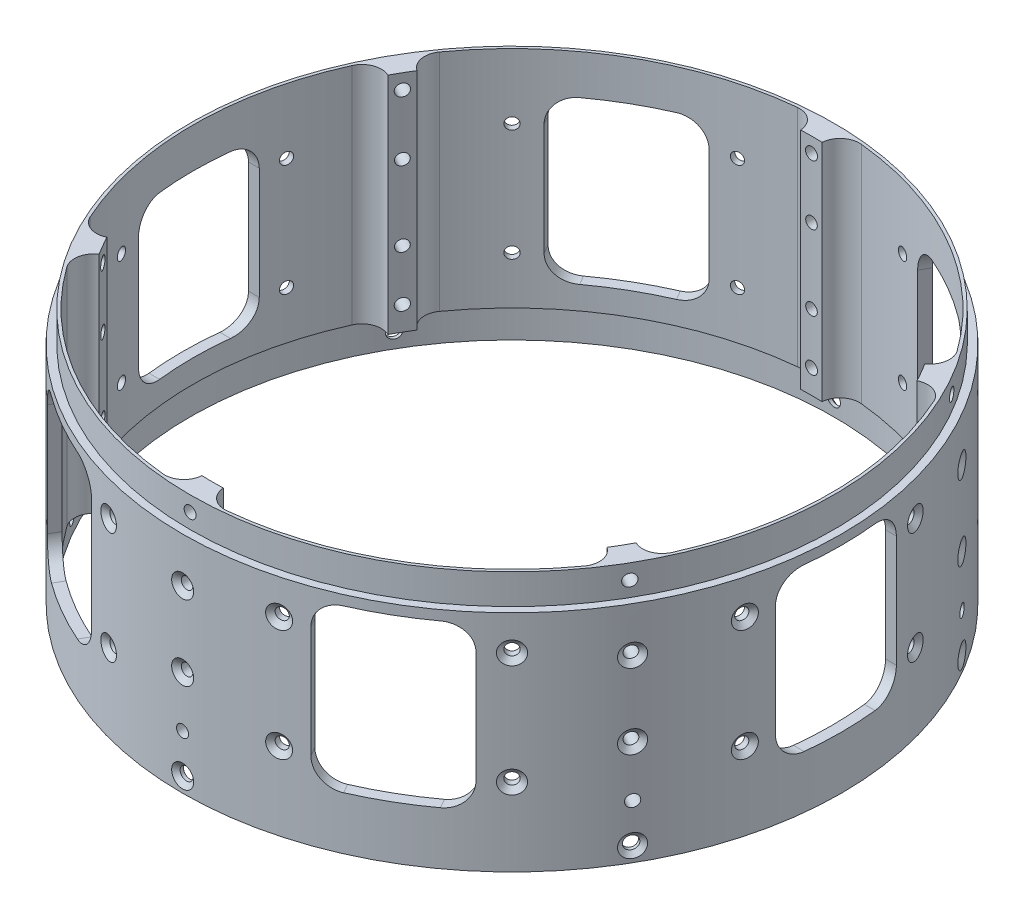
from build123d import *

# Parameters (mm, degrees)
CUT_EXTRUDE1_DEPTH                          = 136.0804860074171
CIRPATTERN1_COUNT                           = 6
TAPPED_HOLE_FOR_4_40_HELICOIL1_AT_2_COUNT   = 2
TAPPED_HOLE_FOR_4_40_HELICOIL1_AT_2_PITCH   = 47.244
CSK_FOR_4_FLAT_HEAD_MACHINE_SCREW_2_A_COUNT = 2
CSK_FOR_4_FLAT_HEAD_MACHINE_SCREW_2_A_PITCH = 19.049999999999997
CIRPATTERN2_COUNT                           = 6
CUT_EXTRUDE2_DEPTH                          = 136.08048618293648
CSK_FOR_4_FLAT_HEAD_MACHINE_SCREW_3_A_COUNT = 2
CSK_FOR_4_FLAT_HEAD_MACHINE_SCREW_3_A_PITCH = 28.448
CIRPATTERN5_COUNT                           = 6


with BuildPart() as part:
    # Sketch1 → Revolve1 (revolve)
    with BuildSketch(Plane.XY):
        Polygon((76.2, -57.15), (76.20000000000003, 0), (81.88960000000003, 0), (81.88960000000003, -7.6708), (83.82000000000004, -7.670799999999989), (83.82000000000004, -64.77), (81.94040000000005, -64.77), (81.94040000000004, -57.15), align=None)
    revolve(axis=Axis((0, 42.39510168777739, 0), (0, -1, 0)))

    # Sketch2 → Cut-Extrude1 (cut, through all)
    with BuildSketch(Plane(origin=(0, 0, 0), x_dir=(1, 0, 0), z_dir=(0, 1, 0))):
        with BuildLine():
            ThreePointArc((-8.128016987239903, 80.71940796125271), (-40.563800000000136, 70.25856254806241), (-65.8410493792649, 47.39877317396734))
            ThreePointArc((-65.8410493792649, 47.39877317396734), (-64.72088607812911, 40.52071256804154), (-57.842825472203295, 41.64087586917733))
            ThreePointArc((-57.842825472203295, 41.64087586917733), (-35.63620000000011, 61.72370898868599), (-7.140643602440563, 70.9137942201863))
            ThreePointArc((-7.140643602440563, 70.9137942201863), (-2.7315234243070465, 76.3102877831192), (-8.128016987239903, 80.71940796125271))
        make_face()
    cut_extrude1 = extrude(amount=-CUT_EXTRUDE1_DEPTH, mode=Mode.SUBTRACT)

    # CirPattern1: Cut-Extrude1 ×6 about axis
    cirpattern1_axis = Axis((0, 42.39510168777739, 0), (0, 1, 0))
    for i in range(1, CIRPATTERN1_COUNT):
        add(cut_extrude1.rotate(cirpattern1_axis, i * 360 / CIRPATTERN1_COUNT), mode=Mode.SUBTRACT)

    # Sketch4 → Tapped Hole for #4-40 Helicoil1 (revolve, cut)
    with BuildSketch(Plane(origin=(0, -3.8099999999999996, 83.82), x_dir=(0, -1, 0), z_dir=(1, 0, 0))):
        Polygon((0, 0), (-6.45e-15, 26.315711583398002), (1.5239999999999854, 25.400000000000006), (1.523999999999989, -1.37e-15), align=None)
    tapped_hole_for_4_40_helicoil1 = revolve(axis=Axis((0, -3.8099999999999996, 90.16999999999999), (0, 0, -1)), mode=Mode.SUBTRACT)

    # Tapped Hole for #4-40 Helicoil1 at 2: Tapped Hole for #4-40 Helicoil1 ×2
    with Locations(*[(0, -i * TAPPED_HOLE_FOR_4_40_HELICOIL1_AT_2_PITCH, 0) for i in range(1, TAPPED_HOLE_FOR_4_40_HELICOIL1_AT_2_COUNT)]):
        add(tapped_hole_for_4_40_helicoil1, mode=Mode.SUBTRACT)

    # Sketch6 → CSK for _4 Flat Head Machine Screw _100 (revolve, cut)
    with BuildSketch(Plane(origin=(1.24e-15, -60.96, 83.82), x_dir=(0, -1, 0), z_dir=(1, 0, 0))):
        Polygon((0, 0), (-6.45e-15, 26.380574487222027), (1.6319499999999938, 25.4), (1.631949999999997, 1.0283585529893176), (2.8575, 0), align=None)
    csk_for_4_flat_head_machine_screw_100 = revolve(axis=Axis((1.24e-15, -60.96, 90.16999999999999), (0, 0, -1)), mode=Mode.SUBTRACT)

    # Sketch9 → CSK for _4 Flat Head Machine Screw _ 2 (revolve, cut)
    with BuildSketch(Plane(origin=(0, -19.049999999999997, 83.82), x_dir=(0, -1, 0), z_dir=(1, 0, 0))):
        Polygon((0, 0), (-6.44e-15, 26.2851878639514), (1.473199999999994, 25.4), (1.473199999999997, 1.1615656194387154), (2.857499999999999, -1.73e-15), align=None)
    csk_for_4_flat_head_machine_screw_2 = revolve(axis=Axis((0, -19.049999999999997, 90.16999999999999), (0, 0, -1)), mode=Mode.SUBTRACT)

    # CSK for _4 Flat Head Machine Screw _ 2 a: CSK for _4 Flat Head Machine Screw _ 2 ×2
    with Locations(*[(0, -i * CSK_FOR_4_FLAT_HEAD_MACHINE_SCREW_2_A_PITCH, 0) for i in range(1, CSK_FOR_4_FLAT_HEAD_MACHINE_SCREW_2_A_COUNT)]):
        add(csk_for_4_flat_head_machine_screw_2, mode=Mode.SUBTRACT)

    # CirPattern2: Tapped Hole for #4-40 Helicoil1, CSK for _4 Flat Head Machine Screw _100, CSK for _4 Flat Head Machine Screw _ 2 ×6 about axis
    cirpattern2_axis = Axis((0, 42.39510168777739, 0), (0, 1, 0))
    add([tapped_hole_for_4_40_helicoil1.rotate(cirpattern2_axis, i * 360 / CIRPATTERN2_COUNT) for i in range(1, CIRPATTERN2_COUNT)], mode=Mode.SUBTRACT)
    add([csk_for_4_flat_head_machine_screw_100.rotate(cirpattern2_axis, i * 360 / CIRPATTERN2_COUNT) for i in range(1, CIRPATTERN2_COUNT)], mode=Mode.SUBTRACT)
    add([csk_for_4_flat_head_machine_screw_2.rotate(cirpattern2_axis, i * 360 / CIRPATTERN2_COUNT) for i in range(1, CIRPATTERN2_COUNT)], mode=Mode.SUBTRACT)

    # CirPattern2 copy 1 sketch → CirPattern2 copy 1 (revolve, cut)
    with BuildSketch(Plane(origin=(72.59024934521163, -51.054, 41.910000000000004), x_dir=(0, -1, 0), z_dir=(0.5000000000000001, 0, -0.8660254037844386))):
        Polygon((0, 0), (-6.45e-15, 26.315711583398002), (1.5239999999999854, 25.400000000000006), (1.523999999999989, -1.37e-15), align=None)
    revolve(axis=Axis((78.08951065924282, -51.054, 45.085), (-0.8660254037844386, 0, -0.5000000000000001)), mode=Mode.SUBTRACT)

    # CirPattern2 copy 2 sketch → CirPattern2 copy 2 (revolve, cut)
    with BuildSketch(Plane(origin=(72.59024934521165, -51.054, -41.909999999999975), x_dir=(0, -1, 0), z_dir=(-0.4999999999999998, 0, -0.8660254037844387))):
        Polygon((0, 0), (-6.45e-15, 26.315711583398002), (1.5239999999999854, 25.400000000000006), (1.523999999999989, -1.37e-15), align=None)
    revolve(axis=Axis((78.08951065924283, -51.054, -45.08499999999997), (-0.8660254037844387, 0, 0.4999999999999998)), mode=Mode.SUBTRACT)

    # CirPattern2 copy 3 sketch → CirPattern2 copy 3 (revolve, cut)
    with BuildSketch(Plane(origin=(1.026e-14, -51.054, -83.82), x_dir=(0, -1, 0), z_dir=(-1, 0, -1.2e-16))):
        Polygon((0, 0), (-6.45e-15, 26.315711583398002), (1.5239999999999854, 25.400000000000006), (1.523999999999989, -1.37e-15), align=None)
    revolve(axis=Axis((1.104e-14, -51.054, -90.16999999999999), (-1.2e-16, 0, 1)), mode=Mode.SUBTRACT)

    # CirPattern2 copy 4 sketch → CirPattern2 copy 4 (revolve, cut)
    with BuildSketch(Plane(origin=(-72.59024934521162, -51.054, -41.91000000000003), x_dir=(0, -1, 0), z_dir=(-0.5000000000000004, 0, 0.8660254037844384))):
        Polygon((0, 0), (-6.45e-15, 26.315711583398002), (1.5239999999999854, 25.400000000000006), (1.523999999999989, -1.37e-15), align=None)
    revolve(axis=Axis((-78.08951065924279, -51.054, -45.085000000000036), (0.8660254037844384, 0, 0.5000000000000004)), mode=Mode.SUBTRACT)

    # CirPattern2 copy 5 sketch → CirPattern2 copy 5 (revolve, cut)
    with BuildSketch(Plane(origin=(-72.59024934521163, -51.054, 41.910000000000004), x_dir=(0, -1, 0), z_dir=(0.5000000000000001, 0, 0.8660254037844386))):
        Polygon((0, 0), (-6.45e-15, 26.315711583398002), (1.5239999999999854, 25.400000000000006), (1.523999999999989, -1.37e-15), align=None)
    revolve(axis=Axis((-78.08951065924282, -51.054, 45.085), (0.8660254037844386, 0, -0.5000000000000001)), mode=Mode.SUBTRACT)

    # CirPattern2 copy 6 sketch → CirPattern2 copy 6 (revolve, cut)
    with BuildSketch(Plane(origin=(72.59024934521163, -38.099999999999994, 41.910000000000004), x_dir=(0, -1, 0), z_dir=(0.5000000000000001, 0, -0.8660254037844386))):
        Polygon((0, 0), (-6.44e-15, 26.2851878639514), (1.473199999999994, 25.4), (1.473199999999997, 1.1615656194387154), (2.857499999999999, -1.73e-15), align=None)
    revolve(axis=Axis((78.08951065924282, -38.099999999999994, 45.085), (-0.8660254037844386, 0, -0.5000000000000001)), mode=Mode.SUBTRACT)

    # CirPattern2 copy 7 sketch → CirPattern2 copy 7 (revolve, cut)
    with BuildSketch(Plane(origin=(72.59024934521165, -38.099999999999994, -41.909999999999975), x_dir=(0, -1, 0), z_dir=(-0.4999999999999998, 0, -0.8660254037844387))):
        Polygon((0, 0), (-6.44e-15, 26.2851878639514), (1.473199999999994, 25.4), (1.473199999999997, 1.1615656194387154), (2.857499999999999, -1.73e-15), align=None)
    revolve(axis=Axis((78.08951065924283, -38.099999999999994, -45.08499999999997), (-0.8660254037844387, 0, 0.4999999999999998)), mode=Mode.SUBTRACT)

    # CirPattern2 copy 8 sketch → CirPattern2 copy 8 (revolve, cut)
    with BuildSketch(Plane(origin=(1.026e-14, -38.099999999999994, -83.82), x_dir=(0, -1, 0), z_dir=(-1, 0, -1.2e-16))):
        Polygon((0, 0), (-6.44e-15, 26.2851878639514), (1.473199999999994, 25.4), (1.473199999999997, 1.1615656194387154), (2.857499999999999, -1.73e-15), align=None)
    revolve(axis=Axis((1.104e-14, -38.099999999999994, -90.16999999999999), (-1.2e-16, 0, 1)), mode=Mode.SUBTRACT)

    # CirPattern2 copy 9 sketch → CirPattern2 copy 9 (revolve, cut)
    with BuildSketch(Plane(origin=(-72.59024934521162, -38.099999999999994, -41.91000000000003), x_dir=(0, -1, 0), z_dir=(-0.5000000000000004, 0, 0.8660254037844384))):
        Polygon((0, 0), (-6.44e-15, 26.2851878639514), (1.473199999999994, 25.4), (1.473199999999997, 1.1615656194387154), (2.857499999999999, -1.73e-15), align=None)
    revolve(axis=Axis((-78.08951065924279, -38.099999999999994, -45.085000000000036), (0.8660254037844384, 0, 0.5000000000000004)), mode=Mode.SUBTRACT)

    # CirPattern2 copy 10 sketch → CirPattern2 copy 10 (revolve, cut)
    with BuildSketch(Plane(origin=(-72.59024934521163, -38.099999999999994, 41.910000000000004), x_dir=(0, -1, 0), z_dir=(0.5000000000000001, 0, 0.8660254037844386))):
        Polygon((0, 0), (-6.44e-15, 26.2851878639514), (1.473199999999994, 25.4), (1.473199999999997, 1.1615656194387154), (2.857499999999999, -1.73e-15), align=None)
    revolve(axis=Axis((-78.08951065924282, -38.099999999999994, 45.085), (0.8660254037844386, 0, -0.5000000000000001)), mode=Mode.SUBTRACT)

    # Sketch7 → Cut-Extrude2 (cut, through all)
    with BuildSketch(Plane(origin=(0, 0, 0), x_dir=(0, 0, -1), z_dir=(1, 0, 0))):
        with BuildLine():
            Line((-9.017000000000003, -10.160000000000002), (9.016999999999996, -10.160000000000002))
            ThreePointArc((9.016999999999996, -10.160000000000002), (13.507128060534573, -12.019871939465428), (15.366999999999996, -16.510000000000005))
            Line((15.366999999999996, -16.510000000000005), (15.366999999999999, -44.958000000000006))
            ThreePointArc((15.366999999999999, -44.958000000000006), (13.507128060534576, -49.448128060534586), (9.017, -51.30800000000001))
            Line((9.017, -51.30800000000001), (-9.017, -51.30800000000001))
            ThreePointArc((-9.017, -51.30800000000001), (-13.507128060534576, -49.44812806053458), (-15.366999999999999, -44.958000000000006))
            Line((-15.366999999999999, -44.958000000000006), (-15.367000000000003, -16.510000000000005))
            ThreePointArc((-15.367000000000003, -16.510000000000005), (-13.507128060534582, -12.019871939465425), (-9.017000000000003, -10.160000000000002))
        make_face()
    cut_extrude2 = extrude(amount=CUT_EXTRUDE2_DEPTH, mode=Mode.SUBTRACT)

    # Sketch12 → CSK for _4 Flat Head Machine Screw _ 3 (revolve, cut)
    with BuildSketch(Plane(origin=(80.96390275954987, -16.510000000000005, -21.694212360492802), x_dir=(-0.2588190451025148, 0, -0.9659258262890699), z_dir=(0, 1, 0))):
        Polygon((0, 0), (-6.42e-15, 26.2851878639514), (1.473199999999994, 25.4), (1.473199999999997, 1.1615656194387118), (2.8575, 0), align=None)
    csk_for_4_flat_head_machine_screw_3 = revolve(axis=Axis((87.09753175648545, -16.510000000000005, -23.337713296893767), (-0.9659258262890699, 0, 0.2588190451025148)), mode=Mode.SUBTRACT)

    # CSK for _4 Flat Head Machine Screw _ 3 a: CSK for _4 Flat Head Machine Screw _ 3 ×2
    with Locations(*[(0, -i * CSK_FOR_4_FLAT_HEAD_MACHINE_SCREW_3_A_PITCH, 0) for i in range(1, CSK_FOR_4_FLAT_HEAD_MACHINE_SCREW_3_A_COUNT)]):
        add(csk_for_4_flat_head_machine_screw_3, mode=Mode.SUBTRACT)

    # Mirror1: CSK for _4 Flat Head Machine Screw _ 3 across plane
    add(csk_for_4_flat_head_machine_screw_3.mirror(Plane.XY), mode=Mode.SUBTRACT)

    # Mirror1 copy 1 sketch → Mirror1 copy 1 (revolve, cut)
    with BuildSketch(Plane(origin=(80.96390275954987, -44.958000000000006, 21.694212360492802), x_dir=(-0.2588190451025148, 0, 0.9659258262890699), z_dir=(0, 1, 0))):
        Polygon((0, 0), (-6.42e-15, -26.2851878639514), (1.473199999999994, -25.4), (1.473199999999997, -1.1615656194387118), (2.8575, 0), align=None)
    revolve(axis=Axis((87.09753175648545, -44.958000000000006, 23.337713296893767), (0.9659258262890699, 0, 0.2588190451025148)), mode=Mode.SUBTRACT)

    # CirPattern5: Cut-Extrude2 ×6 about axis
    cirpattern5_axis = Axis((0, -7.670799999999992, 0), (0, 1, 0))
    for i in range(1, CIRPATTERN5_COUNT):
        add(cut_extrude2.rotate(cirpattern5_axis, i * 360 / CIRPATTERN5_COUNT), mode=Mode.SUBTRACT)

    # CirPattern5 copy 1 sketch → CirPattern5 copy 1 (revolve, cut)
    with BuildSketch(Plane(origin=(59.269690399056074, -16.510000000000005, -59.2696903990568), x_dir=(0.7071067811865519, 0, 0.7071067811865432), z_dir=(0, 1, 0))):
        Polygon((0, 0), (-6.42e-15, -26.2851878639514), (1.473199999999994, -25.4), (1.473199999999997, -1.1615656194387118), (2.8575, 0), align=None)
    revolve(axis=Axis((63.75981845959062, -16.510000000000005, -63.75981845959139), (0.7071067811865432, 0, -0.7071067811865519)), mode=Mode.SUBTRACT)

    # CirPattern5 copy 2 sketch → CirPattern5 copy 2 (revolve, cut)
    with BuildSketch(Plane(origin=(-21.694212360493772, -16.510000000000005, -80.96390275954961), x_dir=(0.9659258262890668, 0, -0.2588190451025265), z_dir=(0, 1, 0))):
        Polygon((0, 0), (-6.42e-15, -26.2851878639514), (1.473199999999994, -25.4), (1.473199999999997, -1.1615656194387118), (2.8575, 0), align=None)
    revolve(axis=Axis((-23.337713296894815, -16.510000000000005, -87.09753175648517), (-0.2588190451025265, 0, -0.9659258262890668)), mode=Mode.SUBTRACT)

    # CirPattern5 copy 3 sketch → CirPattern5 copy 3 (revolve, cut)
    with BuildSketch(Plane(origin=(-80.96390275954987, -16.510000000000005, -21.694212360492813), x_dir=(0.2588190451025149, 0, -0.9659258262890699), z_dir=(0, 1, 0))):
        Polygon((0, 0), (-6.42e-15, -26.2851878639514), (1.473199999999994, -25.4), (1.473199999999997, -1.1615656194387118), (2.8575, 0), align=None)
    revolve(axis=Axis((-87.09753175648545, -16.510000000000005, -23.337713296893778), (-0.9659258262890699, 0, -0.2588190451025149)), mode=Mode.SUBTRACT)

    # CirPattern5 copy 4 sketch → CirPattern5 copy 4 (revolve, cut)
    with BuildSketch(Plane(origin=(-59.2696903990561, -16.510000000000005, 59.26969039905677), x_dir=(-0.7071067811865516, 0, -0.7071067811865435), z_dir=(0, 1, 0))):
        Polygon((0, 0), (-6.42e-15, -26.2851878639514), (1.473199999999994, -25.4), (1.473199999999997, -1.1615656194387118), (2.8575, 0), align=None)
    revolve(axis=Axis((-63.75981845959065, -16.510000000000005, 63.75981845959137), (-0.7071067811865435, 0, 0.7071067811865516)), mode=Mode.SUBTRACT)

    # CirPattern5 copy 5 sketch → CirPattern5 copy 5 (revolve, cut)
    with BuildSketch(Plane(origin=(21.694212360493804, -16.510000000000005, 80.9639027595496), x_dir=(-0.9659258262890666, 0, 0.25881904510252685), z_dir=(0, 1, 0))):
        Polygon((0, 0), (-6.42e-15, -26.2851878639514), (1.473199999999994, -25.4), (1.473199999999997, -1.1615656194387118), (2.8575, 0), align=None)
    revolve(axis=Axis((23.337713296894847, -16.510000000000005, 87.09753175648517), (0.25881904510252685, 0, 0.9659258262890666)), mode=Mode.SUBTRACT)

    # CirPattern5 copy 6 sketch → CirPattern5 copy 6 (revolve, cut)
    with BuildSketch(Plane(origin=(59.269690399056074, -44.958000000000006, -59.2696903990568), x_dir=(0.7071067811865519, 0, 0.7071067811865432), z_dir=(0, 1, 0))):
        Polygon((0, 0), (-6.42e-15, -26.2851878639514), (1.473199999999994, -25.4), (1.473199999999997, -1.1615656194387118), (2.8575, 0), align=None)
    revolve(axis=Axis((63.75981845959062, -44.958000000000006, -63.75981845959139), (0.7071067811865432, 0, -0.7071067811865519)), mode=Mode.SUBTRACT)

    # CirPattern5 copy 7 sketch → CirPattern5 copy 7 (revolve, cut)
    with BuildSketch(Plane(origin=(-21.694212360493772, -44.958000000000006, -80.96390275954961), x_dir=(0.9659258262890668, 0, -0.2588190451025265), z_dir=(0, 1, 0))):
        Polygon((0, 0), (-6.42e-15, -26.2851878639514), (1.473199999999994, -25.4), (1.473199999999997, -1.1615656194387118), (2.8575, 0), align=None)
    revolve(axis=Axis((-23.337713296894815, -44.958000000000006, -87.09753175648517), (-0.2588190451025265, 0, -0.9659258262890668)), mode=Mode.SUBTRACT)

    # CirPattern5 copy 8 sketch → CirPattern5 copy 8 (revolve, cut)
    with BuildSketch(Plane(origin=(-80.96390275954987, -44.958000000000006, -21.694212360492813), x_dir=(0.2588190451025149, 0, -0.9659258262890699), z_dir=(0, 1, 0))):
        Polygon((0, 0), (-6.42e-15, -26.2851878639514), (1.473199999999994, -25.4), (1.473199999999997, -1.1615656194387118), (2.8575, 0), align=None)
    revolve(axis=Axis((-87.09753175648545, -44.958000000000006, -23.337713296893778), (-0.9659258262890699, 0, -0.2588190451025149)), mode=Mode.SUBTRACT)

    # CirPattern5 copy 9 sketch → CirPattern5 copy 9 (revolve, cut)
    with BuildSketch(Plane(origin=(-59.2696903990561, -44.958000000000006, 59.26969039905677), x_dir=(-0.7071067811865516, 0, -0.7071067811865435), z_dir=(0, 1, 0))):
        Polygon((0, 0), (-6.42e-15, -26.2851878639514), (1.473199999999994, -25.4), (1.473199999999997, -1.1615656194387118), (2.8575, 0), align=None)
    revolve(axis=Axis((-63.75981845959065, -44.958000000000006, 63.75981845959137), (-0.7071067811865435, 0, 0.7071067811865516)), mode=Mode.SUBTRACT)

    # CirPattern5 copy 10 sketch → CirPattern5 copy 10 (revolve, cut)
    with BuildSketch(Plane(origin=(21.694212360493804, -44.958000000000006, 80.9639027595496), x_dir=(-0.9659258262890666, 0, 0.25881904510252685), z_dir=(0, 1, 0))):
        Polygon((0, 0), (-6.42e-15, -26.2851878639514), (1.473199999999994, -25.4), (1.473199999999997, -1.1615656194387118), (2.8575, 0), align=None)
    revolve(axis=Axis((23.337713296894847, -44.958000000000006, 87.09753175648517), (0.25881904510252685, 0, 0.9659258262890666)), mode=Mode.SUBTRACT)

    # CirPattern5 copy 11 sketch → CirPattern5 copy 11 (revolve, cut)
    with BuildSketch(Plane(origin=(21.694212360493804, -16.510000000000005, -80.9639027595496), x_dir=(-0.9659258262890666, 0, -0.25881904510252685), z_dir=(0, 1, 0))):
        Polygon((0, 0), (-6.42e-15, 26.2851878639514), (1.473199999999994, 25.4), (1.473199999999997, 1.1615656194387118), (2.8575, 0), align=None)
    revolve(axis=Axis((23.337713296894847, -16.510000000000005, -87.09753175648517), (-0.25881904510252685, 0, 0.9659258262890666)), mode=Mode.SUBTRACT)

    # CirPattern5 copy 12 sketch → CirPattern5 copy 12 (revolve, cut)
    with BuildSketch(Plane(origin=(-59.26969039905605, -16.510000000000005, -59.26969039905681), x_dir=(-0.707106781186552, 0, 0.7071067811865429), z_dir=(0, 1, 0))):
        Polygon((0, 0), (-6.42e-15, 26.2851878639514), (1.473199999999994, 25.4), (1.473199999999997, 1.1615656194387118), (2.8575, 0), align=None)
    revolve(axis=Axis((-63.75981845959059, -16.510000000000005, -63.759818459591415), (0.7071067811865429, 0, 0.707106781186552)), mode=Mode.SUBTRACT)

    # CirPattern5 copy 13 sketch → CirPattern5 copy 13 (revolve, cut)
    with BuildSketch(Plane(origin=(-80.96390275954987, -16.510000000000005, 21.69421236049279), x_dir=(0.2588190451025147, 0, 0.9659258262890699), z_dir=(0, 1, 0))):
        Polygon((0, 0), (-6.42e-15, 26.2851878639514), (1.473199999999994, 25.4), (1.473199999999997, 1.1615656194387118), (2.8575, 0), align=None)
    revolve(axis=Axis((-87.09753175648545, -16.510000000000005, 23.337713296893757), (0.9659258262890699, 0, -0.2588190451025147)), mode=Mode.SUBTRACT)

    # CirPattern5 copy 14 sketch → CirPattern5 copy 14 (revolve, cut)
    with BuildSketch(Plane(origin=(-21.694212360493836, -16.510000000000005, 80.9639027595496), x_dir=(0.9659258262890665, 0, 0.25881904510252723), z_dir=(0, 1, 0))):
        Polygon((0, 0), (-6.42e-15, 26.2851878639514), (1.473199999999994, 25.4), (1.473199999999997, 1.1615656194387118), (2.8575, 0), align=None)
    revolve(axis=Axis((-23.33771329689488, -16.510000000000005, 87.09753175648515), (0.25881904510252723, 0, -0.9659258262890665)), mode=Mode.SUBTRACT)

    # CirPattern5 copy 15 sketch → CirPattern5 copy 15 (revolve, cut)
    with BuildSketch(Plane(origin=(59.269690399056074, -16.510000000000005, 59.2696903990568), x_dir=(0.7071067811865519, 0, -0.7071067811865432), z_dir=(0, 1, 0))):
        Polygon((0, 0), (-6.42e-15, 26.2851878639514), (1.473199999999994, 25.4), (1.473199999999997, 1.1615656194387118), (2.8575, 0), align=None)
    revolve(axis=Axis((63.75981845959062, -16.510000000000005, 63.75981845959139), (-0.7071067811865432, 0, -0.7071067811865519)), mode=Mode.SUBTRACT)

    # CirPattern5 copy 16 sketch → CirPattern5 copy 16 (revolve, cut)
    with BuildSketch(Plane(origin=(21.694212360493804, -44.958000000000006, -80.9639027595496), x_dir=(-0.9659258262890666, 0, -0.25881904510252685), z_dir=(0, 1, 0))):
        Polygon((0, 0), (-6.42e-15, 26.2851878639514), (1.473199999999994, 25.4), (1.473199999999997, 1.1615656194387118), (2.8575, 0), align=None)
    revolve(axis=Axis((23.337713296894847, -44.958000000000006, -87.09753175648517), (-0.25881904510252685, 0, 0.9659258262890666)), mode=Mode.SUBTRACT)

    # CirPattern5 copy 17 sketch → CirPattern5 copy 17 (revolve, cut)
    with BuildSketch(Plane(origin=(-59.26969039905605, -44.958000000000006, -59.26969039905681), x_dir=(-0.707106781186552, 0, 0.7071067811865429), z_dir=(0, 1, 0))):
        Polygon((0, 0), (-6.42e-15, 26.2851878639514), (1.473199999999994, 25.4), (1.473199999999997, 1.1615656194387118), (2.8575, 0), align=None)
    revolve(axis=Axis((-63.75981845959059, -44.958000000000006, -63.759818459591415), (0.7071067811865429, 0, 0.707106781186552)), mode=Mode.SUBTRACT)

    # CirPattern5 copy 18 sketch → CirPattern5 copy 18 (revolve, cut)
    with BuildSketch(Plane(origin=(-80.96390275954987, -44.958000000000006, 21.69421236049279), x_dir=(0.2588190451025147, 0, 0.9659258262890699), z_dir=(0, 1, 0))):
        Polygon((0, 0), (-6.42e-15, 26.2851878639514), (1.473199999999994, 25.4), (1.473199999999997, 1.1615656194387118), (2.8575, 0), align=None)
    revolve(axis=Axis((-87.09753175648545, -44.958000000000006, 23.337713296893757), (0.9659258262890699, 0, -0.2588190451025147)), mode=Mode.SUBTRACT)

    # CirPattern5 copy 19 sketch → CirPattern5 copy 19 (revolve, cut)
    with BuildSketch(Plane(origin=(-21.694212360493836, -44.958000000000006, 80.9639027595496), x_dir=(0.9659258262890665, 0, 0.25881904510252723), z_dir=(0, 1, 0))):
        Polygon((0, 0), (-6.42e-15, 26.2851878639514), (1.473199999999994, 25.4), (1.473199999999997, 1.1615656194387118), (2.8575, 0), align=None)
    revolve(axis=Axis((-23.33771329689488, -44.958000000000006, 87.09753175648515), (0.25881904510252723, 0, -0.9659258262890665)), mode=Mode.SUBTRACT)

    # CirPattern5 copy 20 sketch → CirPattern5 copy 20 (revolve, cut)
    with BuildSketch(Plane(origin=(59.269690399056074, -44.958000000000006, 59.2696903990568), x_dir=(0.7071067811865519, 0, -0.7071067811865432), z_dir=(0, 1, 0))):
        Polygon((0, 0), (-6.42e-15, 26.2851878639514), (1.473199999999994, 25.4), (1.473199999999997, 1.1615656194387118), (2.8575, 0), align=None)
    revolve(axis=Axis((63.75981845959062, -44.958000000000006, 63.75981845959139), (-0.7071067811865432, 0, -0.7071067811865519)), mode=Mode.SUBTRACT)


solid = part.part
